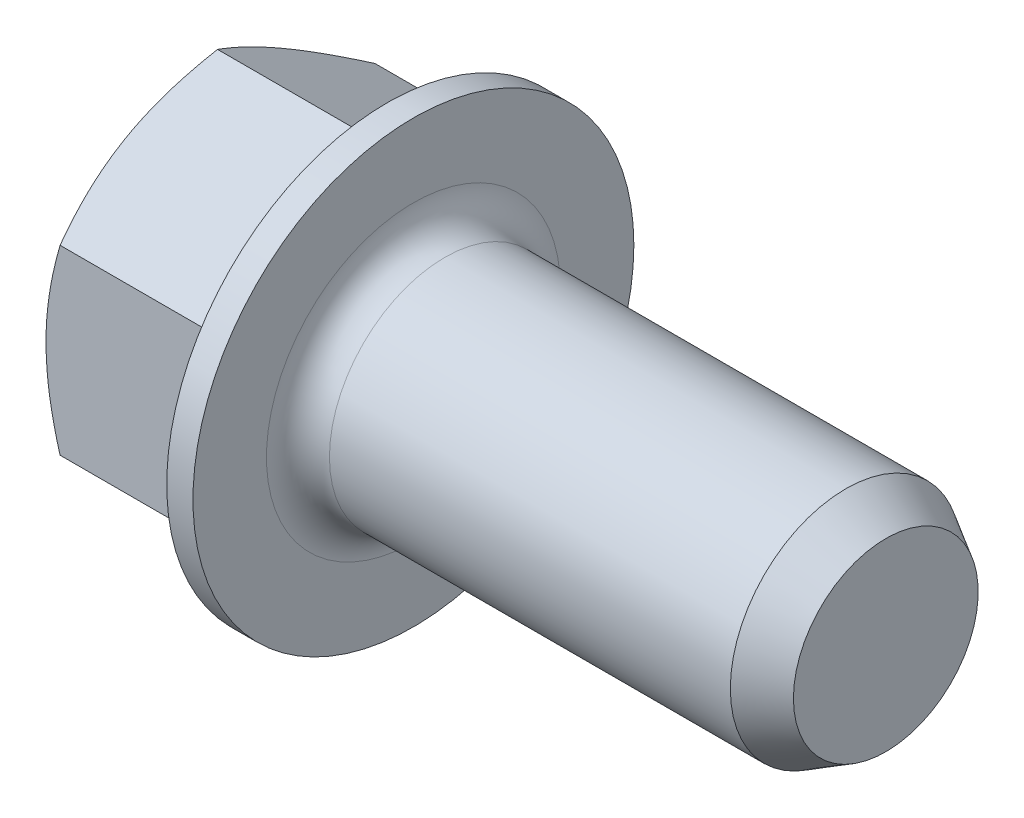
from build123d import *

# Parameters (mm, degrees)
EXTRUDE1_DEPTH = 2
SKETCH4_W      = 1.05
SKETCH4_H      = 1.2
CHAMFER1_SIZE  = 0.22
CHAMFER1_SIZE2 = 0.381051178
FILLET1_R      = 0.3
FILLET2_R      = 0.2


with BuildPart() as part:
    # Sketch1 → Revolve1 (revolve)
    with BuildSketch(Plane.XY):
        Polygon((0, 0), (0, 1.32), (1.75, 1.32), (1.75, 2.1), (2, 2.1), (2, 1.1), (6.5, 1.1), (6.5, 0), align=None)
    revolve(axis=Axis((13.107885839, 0, 0), (-1, 0, 0)))

    # Sketch2 → Extrude1 (add)
    with BuildSketch(Plane.ZY):
        Polygon((1.5, -0.866025404), (1.5, 0.866025404), (0, 1.732050808), (-1.5, 0.866025404), (-1.5, -0.866025404), (0, -1.732050808), align=None)
    extrude(amount=-EXTRUDE1_DEPTH)

    # Sketch3 → Cut-Revolve2 (revolve, cut)
    with BuildSketch(Plane(origin=(0, 0, 0), x_dir=(1, 0, 0), z_dir=(0, 1, 0))):
        Polygon((-0.866025404, 0), (7.794228634, 15), (-0.966025404, 15), (-0.966025404, 0), align=None)
    revolve(axis=Axis((0, 0, 0), (-1, 0, 0)), mode=Mode.SUBTRACT)

    # Sketch4 → Cut-Revolve3 (revolve, cut)
    with BuildSketch(Plane.XY):
        with Locations((0.325, 0.6)):
            Rectangle(SKETCH4_W, SKETCH4_H)
    revolve(axis=Axis((0, 0, 0), (1, 0, 0)), mode=Mode.SUBTRACT)

    # Chamfer1
    chamfer1_edges = [part.edges().sort_by_distance(p)[0] for p in [
        (6.5, -1.1, 0),
    ]]
    chamfer1_side = [part.faces().sort_by_distance(p)[0] for p in [
        (6.5, 0, 0),
    ]]
    chamfer(chamfer1_edges, length=CHAMFER1_SIZE, length2=CHAMFER1_SIZE2, reference=chamfer1_side[0])

    # Fillet1
    fillet1_edges = [part.edges().sort_by_distance(p)[0] for p in [
        (2, -1.1, 0),
    ]]
    fillet(fillet1_edges, radius=FILLET1_R)

    # Fillet2
    fillet2_edges = [part.edges().sort_by_distance(p)[0] for p in [
        (1.75, -1.299038106, -0.75),
        (1.75, 0, -1.5),
        (1.75, 1.299038106, -0.75),
        (1.75, -1.299038106, 0.75),
        (1.75, 0, 1.5),
        (1.75, 1.299038106, 0.75),
    ]]
    fillet(fillet2_edges, radius=FILLET2_R)


solid = part.part
